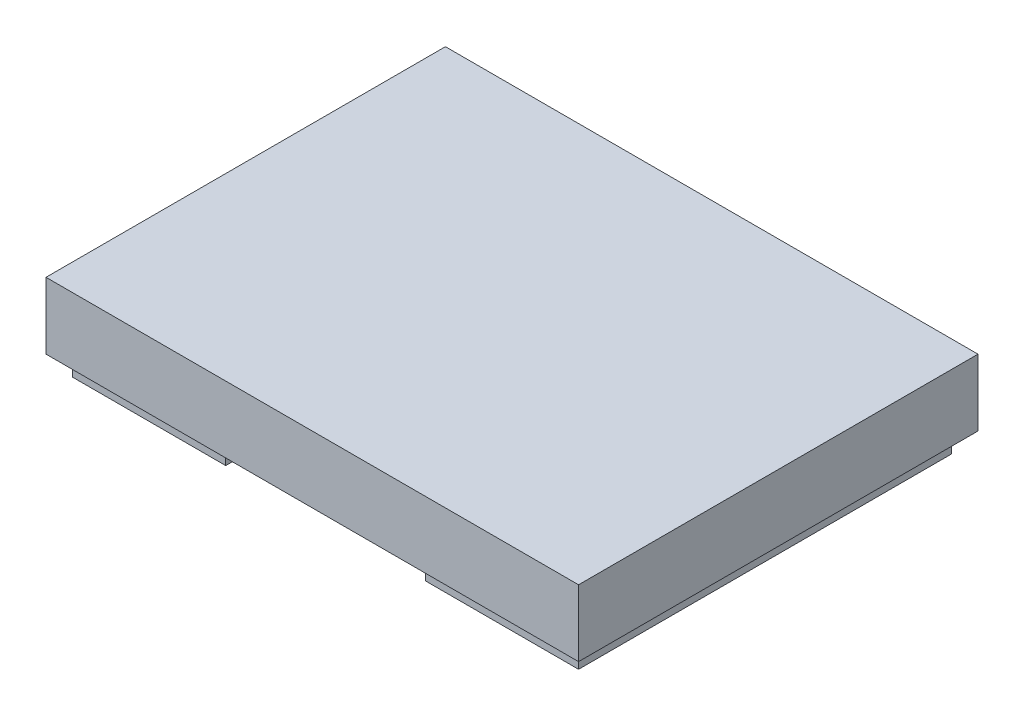
from build123d import *

# Parameters (mm, degrees)
SKETCH1_W           = 101.6
SKETCH1_H           = 76.2
BOSS_EXTRUDE1_DEPTH = 12.7
SKETCH2_W           = 96.52
SKETCH2_H           = 71.12
BOSS_EXTRUDE2_DEPTH = 3.81
SHELL1_T            = -2.54
SKETCH3_W           = 38.1
SKETCH3_H           = 2.54
CUT_EXTRUDE1_DEPTH  = 3.81


with BuildPart() as part:
    # Sketch1 → Boss-Extrude1 (new body)
    with BuildSketch(Plane(origin=(0, 0, 0), x_dir=(1, 0, 0), z_dir=(0, 1, 0))):
        Rectangle(SKETCH1_W, SKETCH1_H)
    extrude(amount=BOSS_EXTRUDE1_DEPTH)

    # Sketch2 → Boss-Extrude2 (add)
    with BuildSketch(Plane(origin=(0, 0, 0), x_dir=(1, 0, 0), z_dir=(0, 1, 0))):
        Rectangle(SKETCH2_W, SKETCH2_H)
    extrude(amount=-BOSS_EXTRUDE2_DEPTH)

    # Shell1
    shell1_openings = [part.faces().sort_by_distance(p)[0] for p in [
        (0, -3.81, 0),
    ]]
    offset(amount=SHELL1_T, openings=shell1_openings, kind=Kind.INTERSECTION)

    # Sketch3 → Cut-Extrude1 (cut)
    with BuildSketch(Plane(origin=(0, 0, 0), x_dir=(1, 0, 0), z_dir=(0, 1, 0))):
        with Locations((0, -34.29)):
            Rectangle(SKETCH3_W, SKETCH3_H)
    extrude(amount=-CUT_EXTRUDE1_DEPTH, mode=Mode.SUBTRACT)


solid = part.part
